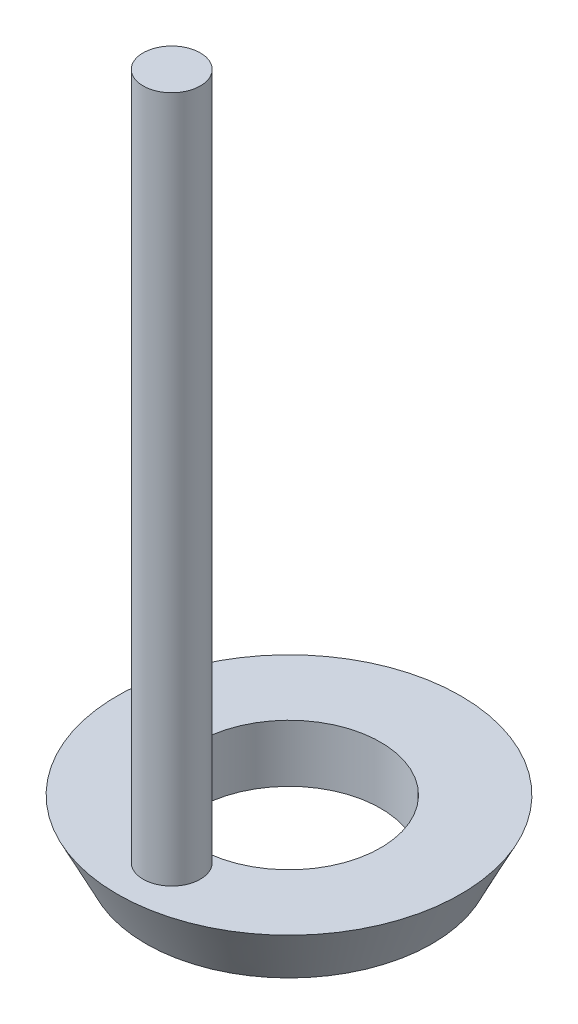
from build123d import *

# Parameters (mm, degrees)
SKETCH1_R           = 3
BOSS_EXTRUDE1_DEPTH = 1
SKETCH2_R           = 1.6
CUT_EXTRUDE1_DEPTH  = 1
SKETCH3_R           = 0.5
BOSS_EXTRUDE2_DEPTH = 12
CHAMFER1_SIZE       = 1
CHAMFER1_SIZE_2     = 0.5


with BuildPart() as part:
    # Sketch1 → Boss-Extrude1 (new body)
    with BuildSketch(Plane(origin=(0, 0, 0), x_dir=(1, 0, 0), z_dir=(0, 1, 0))):
        with Locations(Location((0, 0, 0), (0, 0, 270))):
            Circle(SKETCH1_R)
    extrude(amount=BOSS_EXTRUDE1_DEPTH)

    # Sketch2 → Cut-Extrude1 (cut)
    with BuildSketch(Plane(origin=(0, 1, 0), x_dir=(1, 0, 0), z_dir=(0, 1, 0))):
        with Locations(Location((0, 0, 0), (0, 0, 270))):
            Circle(SKETCH2_R)
    extrude(amount=-CUT_EXTRUDE1_DEPTH, mode=Mode.SUBTRACT)

    # Sketch3 → Boss-Extrude2 (add)
    with BuildSketch(Plane(origin=(0, 1, 0), x_dir=(1, 0, 0), z_dir=(0, 1, 0))):
        with Locations(Location((0, -2.048388822, 0), (0, 0, 112.975296156))):
            Circle(SKETCH3_R)
    extrude(amount=BOSS_EXTRUDE2_DEPTH)

    # Chamfer1
    # the kernel refuses this chamfer: 1, 0.5 mm, written as the material it takes off along each edge
    with BuildSketch(Plane(origin=(0, 0, 0), x_dir=(0, 0, 1), z_dir=(-1, 0, 0))) as chamfer1_piece_1:
        Polygon((3, CHAMFER1_SIZE), (3 - CHAMFER1_SIZE_2, 0), (3, 0), align=None)
    revolve(axis=Axis((0, 0, 0), (0, 1, 0)), mode=Mode.SUBTRACT)


solid = part.part
